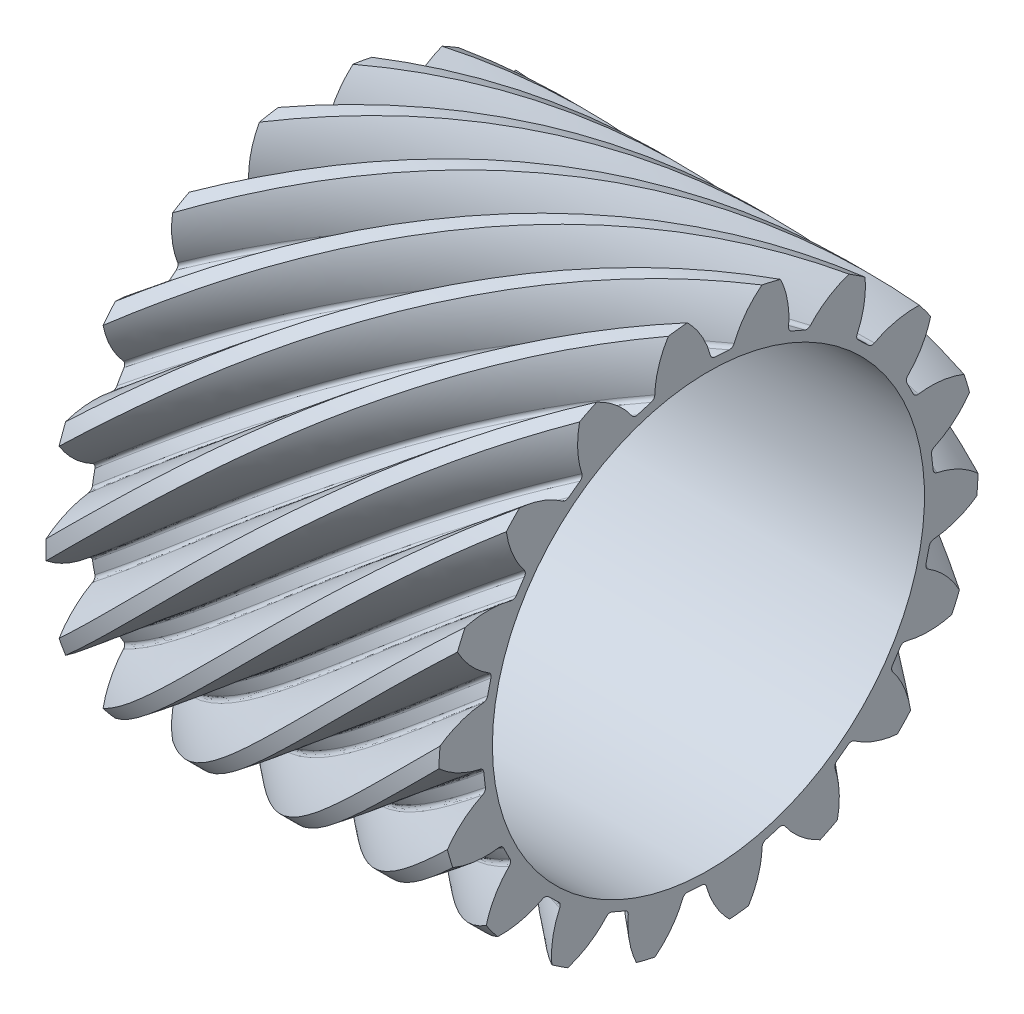
from build123d import *

# Parameters (mm, degrees)
BASPROSKE_W            = 10
BASPROSKE_H            = 6.863961031
TOOTHCUTRH_PITCH       = 43.127539097
TOOTHCUTRH_HEIGHT      = 10
TOOTHCUTRH_RADIUS      = 6.863961031
TOOTHCUTRH_START_ANGLE = -90
TEETHCUTSRH_COUNT      = 18
TEETHCUTSRH_ANGLE      = 340
BORSKE_R               = 4.056058262
BORE_DEPTH             = 62.5000025
CUT_EXTRUDE1_REACH     = 15.937
SKETCH3_R              = 5.5


with BuildPart() as part:
    # BasProSke → Base-Revolve (revolve)
    with BuildSketch(Plane(origin=(0, 0, 0), x_dir=(1, 0, 0), z_dir=(0, 1, 0)), mode=Mode.PRIVATE) as base_revolve_sk:
        with Locations((5, 3.431980516)):
            Rectangle(BASPROSKE_W, BASPROSKE_H)
    revolve(base_revolve_sk.sketch.rotate(Axis((-10, 0, 0), (1, 0, 0)), 180), axis=Axis((-10, 0, 0), (1, 0, 0)))

    # ToothCutRH: sweep along a helix
    with BuildLine() as toothcutrh_path:
        add(Helix(TOOTHCUTRH_PITCH, TOOTHCUTRH_HEIGHT, TOOTHCUTRH_RADIUS, center=(0, 0, 0), direction=(1, 0, 0), lefthand=True, mode=Mode.PRIVATE).rotate(Axis((0, 0, 0), (1, 0, 0)), TOOTHCUTRH_START_ANGLE))
    # TooCutSkeRH → ToothCutRH (sweep, cut)
    with BuildSketch(Plane(origin=(0, 0, 0), x_dir=(0, 0, -1), z_dir=(1, 0, 0))):
        with BuildLine():
            ThreePointArc((0.179412532, 5.73615593), (0, 5.738961031), (-0.179412532, 5.73615593))
            ThreePointArc((-0.179412532, 5.73615593), (-0.255333771, 5.758679825), (-0.302820497, 5.822054672))
            ThreePointArc((-0.302820497, 5.822054672), (-0.644944266, 6.468649189), (-1.176412669, 6.971316553))
            ThreePointArc((-1.176412669, 6.971316553), (0, 7.069879862), (1.176412669, 6.971316553))
            ThreePointArc((1.176412669, 6.971316553), (0.644944266, 6.468649189), (0.302820497, 5.822054672))
            ThreePointArc((0.302820497, 5.822054672), (0.255333771, 5.758679825), (0.179412532, 5.73615593))
        make_face()
    toothcutrh = sweep(path=toothcutrh_path.line, is_frenet=True, mode=Mode.SUBTRACT)

    # TeethCutsRH: ToothCutRH ×18 about axis
    teethcutsrh_axis = Axis((-10, 0, 0), (1, 0, 0))
    for i in range(1, TEETHCUTSRH_COUNT):
        add(toothcutrh.rotate(teethcutsrh_axis, i * TEETHCUTSRH_ANGLE / (TEETHCUTSRH_COUNT - 1)), mode=Mode.SUBTRACT)

    # BorSke → Bore (cut, symmetric)
    with BuildSketch(Plane(origin=(0, 0, 0), x_dir=(0, 0, -1), z_dir=(1, 0, 0))):
        with Locations(Location((0, 0, 0), (0, 0, 180))):
            Circle(BORSKE_R)
    extrude(amount=BORE_DEPTH, both=True, mode=Mode.SUBTRACT)

    # Sketch3 → Cut-Extrude1 (cut, up to next)
    with BuildSketch(Plane.ZY, mode=Mode.PRIVATE) as cut_extrude1_sk1:
        Circle(SKETCH3_R)
    cut_extrude1_tool1 = extrude(cut_extrude1_sk1.sketch, amount=-CUT_EXTRUDE1_REACH, mode=Mode.PRIVATE) & part.part
    add(cut_extrude1_tool1.solids().sort_by_distance((0, 0, 0))[0], mode=Mode.SUBTRACT)


solid = part.part
